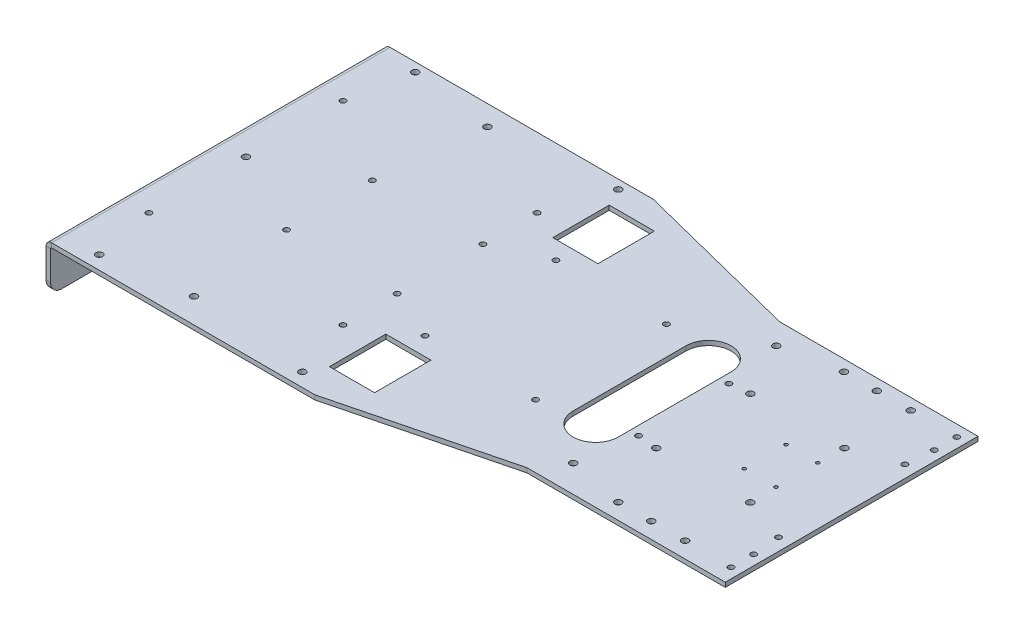
from build123d import *

# Parameters (mm, degrees)
BRIDA_BASE1_DEPTH                = 2
CROQUIS9_R                       = 1.5
CROQUIS9_R_2                     = 1.25
CROQUIS9_R_3                     = 0.75
CROQUIS9_W                       = 20
CROQUIS9_H                       = 25
CORTAR_EXTRUIR2_DEPTH            = 159.836393815
BRIDA_DE_ARISTA1_STRIP_W         = 9
BRIDA_DE_ARISTA1_STRIP_H         = 2
BRIDA_DE_ARISTA1_STRIP_CUT_DEPTH = 150
BRIDA_DE_ARISTA1_DEPTH           = 150
CROQUIS13_R                      = 1.5
CROQUIS13_W                      = 100
CROQUIS13_H                      = 7
CORTAR_EXTRUIR3_DEPTH            = 10
REDONDEO2_R                      = 5


# Sheet-metal steps are written as plain solids
with BuildPart() as part:
    # Croquis base → Brida base1 (new body)
    with BuildSketch(Plane(origin=(0, 0, 0), x_dir=(1, 0, 0), z_dir=(0, 1, 0))):
        Polygon((-140, 75), (-22.9, 75), (52.1, 56), (140, 56), (140, -56), (52.1, -56), (-22.9, -75), (-140, -75), align=None)
    extrude(amount=-BRIDA_BASE1_DEPTH)

    # Croquis9 → Cortar-Extruir2 (cut, through all)
    with BuildSketch(Plane(origin=(0, 0, 0), x_dir=(1, 0, 0), z_dir=(0, 1, 0))):
        with Locations(Location((85.579206262, -48.986389042, 0), (0, 0, 270))):
            Circle(CROQUIS9_R)
        with Locations(Location((100.179206262, -48.986389042, 0), (0, 0, 270))):
            Circle(CROQUIS9_R)
        with Locations(Location((115.179206262, -48.986389042, 0), (0, 0, 270))):
            Circle(CROQUIS9_R)
        with Locations(Location((135.579206262, -48.986389042, 0), (0, 0, 270))):
            Circle(CROQUIS9_R_2)
        with Locations(Location((-124.420793738, -68.986389042, 0), (0, 0, 270))):
            Circle(CROQUIS9_R)
        with Locations(Location((-34.420793738, -68.986389042, 0), (0, 0, 270))):
            Circle(CROQUIS9_R)
        with Locations(Location((-87.420825, -64, 0), (0, 0, 270))):
            Circle(CROQUIS9_R)
        with Locations(Location((-129.420793738, -41.986389042, 0), (0, 0, 270))):
            Circle(CROQUIS9_R_2)
        with Locations(Location((-43.420793738, -41.986389042, 0), (0, 0, 270))):
            Circle(CROQUIS9_R_2)
        with Locations(Location((60.5792, -43.986389042, 0), (0, 0, 270))):
            Circle(CROQUIS9_R)
        with Locations(Location((135.579206262, -38.986389042, 0), (0, 0, 270))):
            Circle(CROQUIS9_R_2)
        with Locations(Location((134.579206262, -26.986389042, 0), (0, 0, 270))):
            Circle(CROQUIS9_R_2)
        with Locations(Location((-92.420793738, -17.986389042, 0), (0, 0, 270))):
            Circle(CROQUIS9_R_2)
        with Locations(Location((-43.420793738, -17.986389042, 0), (0, 0, 270))):
            Circle(CROQUIS9_R_2)
        with Locations(Location((-21.075793738, -27.986389042, 0), (0, 0, 270))):
            Circle(CROQUIS9_R_2)
        with Locations(Location((27.924206262, -27.986389042, 0), (0, 0, 270))):
            Circle(CROQUIS9_R_2)
        with Locations(Location((64.579206262, -18.986389042, 0), (0, 0, 270))):
            Circle(CROQUIS9_R_2)
        with Locations(Location((114.939206262, -19.846389042, 0), (0, 0, 270))):
            Circle(CROQUIS9_R)
        with Locations(Location((73.219206262, -19.846389042, 0), (0, 0, 270))):
            Circle(CROQUIS9_R)
        with Locations(Location((100.679206262, -8.236389042, 0), (0, 0, 270))):
            Circle(CROQUIS9_R_3)
        with Locations(Location((114.679206262, -8.236389042, 0), (0, 0, 270))):
            Circle(CROQUIS9_R_3)
        with Locations(Location((-124.420793738, 71.013610958, 0), (0, 0, 90))):
            Circle(CROQUIS9_R)
        with Locations(Location((-129.420793738, 44.013610958, 0), (0, 0, 90))):
            Circle(CROQUIS9_R_2)
        with Locations(Location((-87.420825, 66.027221915, 0), (0, 0, 90))):
            Circle(CROQUIS9_R)
        with Locations(Location((-92.420793738, 20.013610958, 0), (0, 0, 90))):
            Circle(CROQUIS9_R_2)
        with Locations(Location((-43.420793738, 20.013610958, 0), (0, 0, 90))):
            Circle(CROQUIS9_R_2)
        with Locations(Location((-43.420793738, 44.013610958, 0), (0, 0, 90))):
            Circle(CROQUIS9_R_2)
        with Locations(Location((-34.420793738, 71.013610958, 0), (0, 0, 90))):
            Circle(CROQUIS9_R)
        with Locations(Location((-21.075793738, 30.013610958, 0), (0, 0, 90))):
            Circle(CROQUIS9_R_2)
        with Locations(Location((115.179206262, 51.013610958, 0), (0, 0, 90))):
            Circle(CROQUIS9_R)
        with Locations(Location((27.924206262, 30.013610958, 0), (0, 0, 90))):
            Circle(CROQUIS9_R_2)
        with Locations(Location((64.579206262, 21.013610958, 0), (0, 0, 90))):
            Circle(CROQUIS9_R_2)
        with Locations(Location((73.219206262, 21.873610958, 0), (0, 0, 90))):
            Circle(CROQUIS9_R)
        with Locations(Location((60.5792, 46.013610958, 0), (0, 0, 90))):
            Circle(CROQUIS9_R)
        with Locations(Location((85.579206262, 51.013610958, 0), (0, 0, 90))):
            Circle(CROQUIS9_R)
        with Locations(Location((100.179206262, 51.013610958, 0), (0, 0, 90))):
            Circle(CROQUIS9_R)
        with Locations(Location((100.679206262, 10.263610958, 0), (0, 0, 90))):
            Circle(CROQUIS9_R_3)
        with Locations(Location((114.679206262, 10.263610958, 0), (0, 0, 90))):
            Circle(CROQUIS9_R_3)
        with Locations(Location((114.939206262, 21.873610958, 0), (0, 0, 90))):
            Circle(CROQUIS9_R)
        with Locations(Location((134.579206262, 29.013610958, 0), (0, 0, 90))):
            Circle(CROQUIS9_R_2)
        with Locations(Location((135.579206262, 41.013610958, 0), (0, 0, 90))):
            Circle(CROQUIS9_R_2)
        with Locations(Location((135.579206262, 51.013610958, 0), (0, 0, 90))):
            Circle(CROQUIS9_R_2)
        with Locations(Location((-129.420793738, 1.013610958, 0), (0, 0, 270))):
            Circle(CROQUIS9_R)
        with Locations((-20.420793738, -48.486389042)):
            Rectangle(CROQUIS9_W, CROQUIS9_H)
        with BuildLine():
            Line((60.579206262, 26.013610958), (60.579206262, -23.986389042))
            ThreePointArc((60.579206262, -23.986389042), (50.579206262, -33.986389042), (40.579206262, -23.986389042))
            Line((40.579206262, -23.986389042), (40.579206262, 26.013610958))
            ThreePointArc((40.579206262, 26.013610958), (50.579206262, 36.013610958), (60.579206262, 26.013610958))
        make_face()
        with Locations((-20.420793738, 50.513610958)):
            Rectangle(CROQUIS9_W, CROQUIS9_H)
    extrude(amount=-CORTAR_EXTRUIR2_DEPTH, mode=Mode.SUBTRACT)

    # Brida de arista1 strip (across the edge) → Brida de arista1 strip cut (cut)
    with BuildSketch(Plane(origin=(-140, -2, 75), x_dir=(1, 0, 0), z_dir=(0, 0, -1))):
        with Locations((-4, -1)):
            Rectangle(BRIDA_DE_ARISTA1_STRIP_W, BRIDA_DE_ARISTA1_STRIP_H)
    extrude(amount=BRIDA_DE_ARISTA1_STRIP_CUT_DEPTH, mode=Mode.SUBTRACT)

    # Brida de arista1 section (across the edge) → Brida de arista1 (add)
    with BuildSketch(Plane(origin=(-140, -2, 75), x_dir=(1, 0, 0), z_dir=(0, 0, -1))):
        with BuildLine():
            Line((-2, 0.5), (-2, 18.4))
            Line((-2, 18.4), (0, 18.4))
            Line((0, 18.4), (0, 0.5))
            ThreePointArc((0, 0.5), (0.146446609, 0.146446609), (0.5, 0))
            Line((0.5, 0), (0.5, -2))
            ThreePointArc((0.5, -2), (-1.267766953, -1.267766953), (-2, 0.5))
        make_face()
    extrude(amount=BRIDA_DE_ARISTA1_DEPTH)

    # Croquis13 → Cortar-Extruir3 (cut)
    with BuildSketch(Plane.ZY.offset(142)):
        with Locations(Location((55, -14.4, 0), (0, 0, 270))):
            Circle(CROQUIS13_R)
        with Locations(Location((-55, -14.4, 0), (0, 0, 270))):
            Circle(CROQUIS13_R)
        with Locations((0, -14.4)):
            Rectangle(CROQUIS13_W, CROQUIS13_H)
    extrude(amount=-CORTAR_EXTRUIR3_DEPTH, mode=Mode.SUBTRACT)

    # Redondeo2
    redondeo2_edges = [part.edges().sort_by_distance(p)[0] for p in [
        (-141, -20.4, 75),
        (-141, -20.4, -75),
    ]]
    fillet(redondeo2_edges, radius=REDONDEO2_R)


solid = part.part
